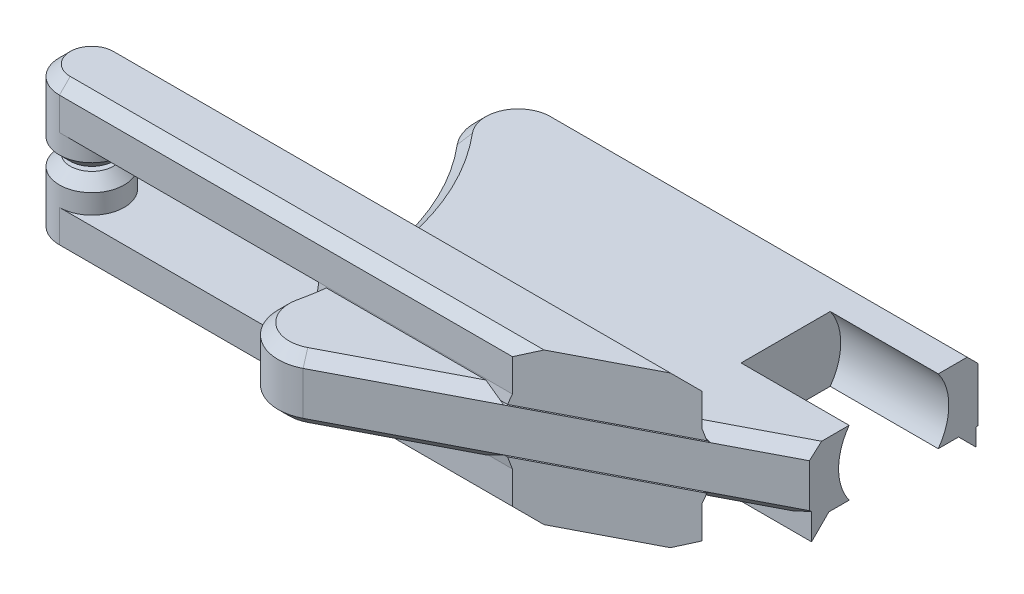
from build123d import *
from build123d.topology import SkipClean

# Parameters (mm, degrees)
BOSS_EXTRUDE1_DEPTH      = 1.5
SKETCH3_R                = 2.5500000000000003
CUT_EXTRUDE1_DEPTH       = 5
BOSS_EXTRUDE2_DEPTH      = 2
CUT_EXTRUDE2_DEPTH       = 35.91480579173508
BOSS_EXTRUDE4_REACH      = 25.469
SKETCH8_R                = 1.499999999999997
BOSS_EXTRUDE5_DEPTH      = 1.4
FILLET1_R                = 2
BOSS_EXTRUDE6_REACH      = 35.939
BOSS_EXTRUDE6_END_RADIUS = 12
MIRROR2_START            = -24.981035963
MIRROR2_DEPTH            = 24.981035963
MIRROR2_START_2          = -3
MIRROR2_2_DEPTH          = 1.5
CUT_EXTRUDE4_DEPTH       = 35.12603615991723
CHAMFER2_SIZE            = 0.5
CHAMFER1_SIZE            = 0.5


with BuildPart() as part:
    # Sketch2 → Boss-Extrude1 (new, symmetric)
    with BuildSketch(Plane(origin=(0, 0, 0), x_dir=(1, 0, 0), z_dir=(0, 1, 0))):
        with BuildLine():
            Line((0, -3.9000000000000075), (0, 3.899999999999993))
            Line((0, 3.899999999999993), (-25.204168476687265, 3.899999999999991))
            ThreePointArc((-25.204168476687265, 3.899999999999991), (-18.343183564475204, -4.250678924992998), (-20.67057742658785, -14.647309086469686))
            Line((-20.67057742658785, -14.647309086469686), (0, -3.9000000000000075))
        make_face()
    extrude(amount=BOSS_EXTRUDE1_DEPTH, both=True)

    # Sketch3 → Cut-Extrude1 (cut)
    with BuildSketch(Plane(origin=(0, 0, 0), x_dir=(0, 0, -1), z_dir=(1, 0, 0))):
        Circle(SKETCH3_R)
    extrude(amount=-CUT_EXTRUDE1_DEPTH, mode=Mode.SUBTRACT)

    # Sketch5 → Cut-Extrude2 (cut, through all)
    with BuildSketch(Plane(origin=(0, 0, 0), x_dir=(0, 0, -1), z_dir=(1, 0, 0))):
        Polygon((-8.650000000000004, 1.5), (-8.73816349035424, 0.9999999999999993), (-5.461836509645769, 0.9999999999999993), (-5.550000000000004, 1.5), align=None)
    cut_extrude2 = extrude(amount=-CUT_EXTRUDE2_DEPTH, mode=Mode.SUBTRACT)

    # Mirror1: Cut-Extrude2 across plane
    add(cut_extrude2.mirror(Plane.ZX), mode=Mode.SUBTRACT)

    # Fillet1
    fillet1_edges = [part.edges().sort_by_distance(p)[0] for p in [
        (-20.67057742658785, 0, 14.647309086469686),
        (-25.204168476687265, 0, -3.8999999999999906),
    ]]
    fillet(fillet1_edges, radius=FILLET1_R)

    # Boss-Extrude6: up to this cylinder (the profile starts outside it)
    boss_extrude6_end = Plane(origin=(-30, -1.766667, 7.100000000000005), z_dir=(0, 1, 0)) * Cylinder(BOSS_EXTRUDE6_END_RADIUS, 96.878, mode=Mode.PRIVATE)
    # Sketch9 → Boss-Extrude6 (add, up to the surface)
    with BuildSketch(Plane(origin=(0, 0, 0), x_dir=(0, 0, -1), z_dir=(1, 0, 0)), mode=Mode.PRIVATE) as boss_extrude6_sk1:
        Polygon((-3.7999999999999994, -1.5), (-3.8, -2.3), (-3, -1.5), align=None)
    boss_extrude6_tool1 = extrude(boss_extrude6_sk1.sketch, amount=-BOSS_EXTRUDE6_REACH, mode=Mode.PRIVATE) - boss_extrude6_end
    add(boss_extrude6_tool1.solids().sort_by_distance((0, -1.766667, 3.533333))[0])

    # Mirror2: read off the stored shape, not the designer's step
    # Mirror2 outline → Mirror2 (add)
    with BuildSketch(Plane.YZ.offset(MIRROR2_START)):
        Polygon((-1.5, -3.8), (-1.5, -3), (-2.3, -3.8), align=None)
    extrude(amount=MIRROR2_DEPTH)

    # Mirror2 2 outline → Mirror2 2 (cut)
    with BuildSketch(Plane(origin=(0, 0, 0), x_dir=(1, 0, 0), z_dir=(0, 1, 0)).offset(MIRROR2_START_2)):
        with BuildLine():
            Line((-22, 2.024776923), (-23.520030864, 3))
            ThreePointArc((-23.520030864, 3), (-24.236635876, 3.425380467), (-24.981035963, 3.8))
            Line((-24.981035963, 3.8), (-24.981035963, 1))
            Line((-24.981035963, 1), (-22, 1))
            Line((-22, 1), (-22, 2.024776923))
        make_face()
    extrude(amount=MIRROR2_2_DEPTH, mode=Mode.SUBTRACT)

    # Sketch10 → Cut-Extrude4 (cut, through all)
    with BuildSketch(Plane(origin=(0, -1.5, 0), x_dir=(1, 0, 0), z_dir=(0, 1, 0))):
        with BuildLine():
            Line((-19.900694505076203, 3.799999999999999), (-24.98103596346817, 3.8000000000000003))
            ThreePointArc((-24.98103596346817, 3.8000000000000003), (-24.2366358760677, 3.4253804669935803), (-23.520030864271043, 3))
            Line((-23.520030864271043, 3), (-20.946524014085387, 3))
            ThreePointArc((-20.946524014085387, 3), (-20.491332623137634, 3.488533865071372), (-19.900694505076203, 3.799999999999999))
        make_face()
    extrude(amount=-CUT_EXTRUDE4_DEPTH, mode=Mode.SUBTRACT)

    # Chamfer1
    chamfer1_edges = [part.edges().sort_by_distance(p)[0] for p in [
        (-1.5867438295232468, 1.5, 4.725000000000003),
        (-9.638097352618193, 1.5, -3.899999999999992),
        (-21.088848639586317, 1.5, -2.745154254728507),
        (-19.01317053469328, 1.5, 2.2740722860502682),
        (-18.181494014390573, 1.5, 9.17916239580129),
        (-17.552032906206957, 1.5, 11.724261681549507),
        (-12.27341621121789, 1.5, 10.281350401908949),
        (-21.27283986088827, -1.5, -1.784206552811166),
        (-19.606839169271502, -1.5, 1.1014828543538435),
        (-1.5867438295232468, -1.5, 4.725000000000003),
        (-18.181494014390573, -1.5, 9.17916239580129),
        (-17.552032906206957, -1.5, 11.724261681549507),
        (-12.27341621121789, -1.5, 10.281350401908949),
    ]]
    chamfer(chamfer1_edges, length=CHAMFER1_SIZE)


with BuildPart() as body_2:
    # Sketch4 → Boss-Extrude2 (new body)
    with BuildSketch(Plane(origin=(0, 1.5, 0), x_dir=(1, 0, 0), z_dir=(0, 1, 0))):
        with BuildLine():
            Line((-30, -5.600000000000004), (-3.2696539517448784, -5.600000000000004))
            Line((-3.2696539517448784, -5.600000000000004), (-9.039631513647626, -8.600000000000003))
            Line((-9.039631513647626, -8.600000000000003), (-30, -8.600000000000003))
            ThreePointArc((-30, -8.600000000000003), (-31.5, -7.100000000000005), (-30, -5.600000000000004))
        make_face()
    extrude(amount=BOSS_EXTRUDE2_DEPTH)

    # Boss-Extrude4: up to this plane
    boss_extrude4_end = Plane(origin=(-3.2696539517448784, 3.5, 5.600000000000004), z_dir=(-0.46130573246151213, 0, -0.8872412418266792))
    # Sketch6 → Boss-Extrude4 (add, up to the surface)
    with BuildSketch(Plane.ZY.offset(18), mode=Mode.PRIVATE) as boss_extrude4_sk1:
        Polygon((5.600000000000004, 1.5), (5.52142418927548, 1.0499999999999996), (8.678575810724528, 1.0499999999999994), (8.600000000000003, 1.5), align=None)
    boss_extrude4_tool1 = split(extrude(boss_extrude4_sk1.sketch, amount=-BOSS_EXTRUDE4_REACH, mode=Mode.PRIVATE), bisect_by=boss_extrude4_end, keep=Keep.BOTH, mode=Mode.PRIVATE)
    add(boss_extrude4_tool1.solids().sort_by_distance((-18, 1.273086, 7.1))[0])

    # Sketch8 → Boss-Extrude5 (add)
    with SkipClean():  # the faces are left unmerged after this step: merging them gives an invalid solid
        with BuildSketch(Plane.XZ.offset(-1.5)):
            with Locations(Location((-30, 7.100000000000005, 0), (0, 0, 270))):
                Circle(SKETCH8_R)
        extrude(amount=BOSS_EXTRUDE5_DEPTH)

    # Chamfer2
    chamfer2_edges = [body_2.edges().sort_by_distance(p)[0] for p in [
        (-16.63482697587244, 3.5, 5.600000000000004),
        (-30, 0.10000000000000009, 8.600000000000001),
        (-31.5, 3.5, 7.100000000000003),
        (-19.51981575682381, 3.5, 8.600000000000003),
    ]]
    chamfer(chamfer2_edges, length=CHAMFER2_SIZE)


with BuildPart() as body_3:
    # Mirror3: mirrored copy
    add(body_2.part.mirror(Plane.ZX))


solid = Compound([part.part, body_2.part, body_3.part])
